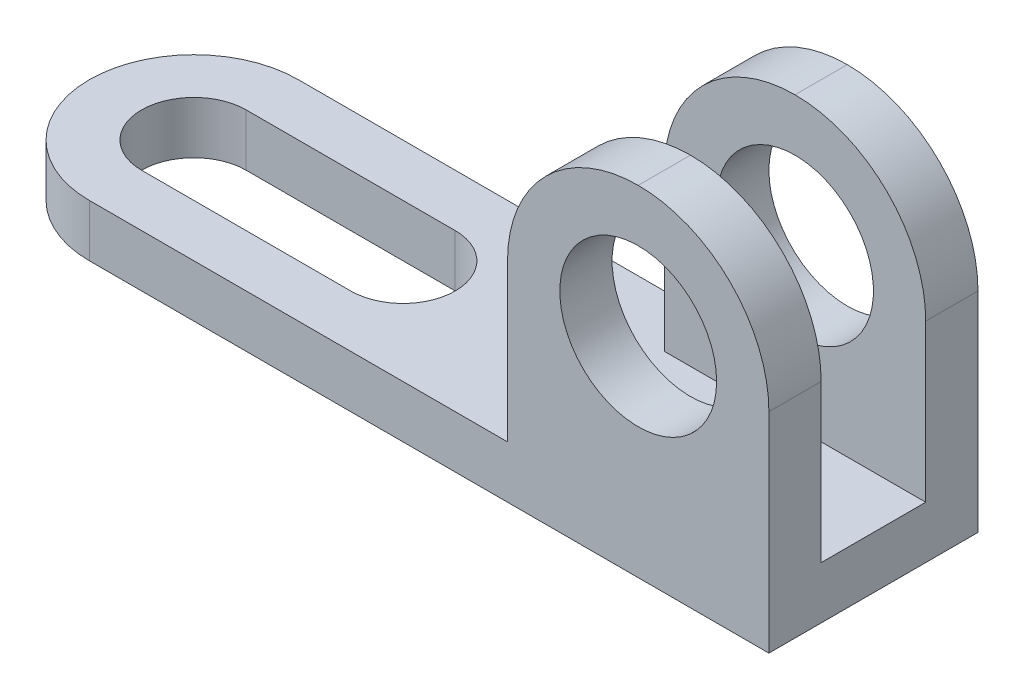
from build123d import *

# Parameters (mm, degrees)
SKETCH2_W            = 150
SKETCH2_H            = 40
BOSS_EXTRUDE1_DEPTH  = 10
FILLET2_R            = 20
SKETCH10_W           = 50
SKETCH10_H           = 10
BOSS_EXTRUDE4_DEPTH  = 55
SKETCH12_R           = 15
CUT_EXTRUDE2_DEPTH   = 10
FILLET3_R            = 25
FILLET3_OF_MIRROR1_R = 25
FILLET4_R            = 20
CUT_EXTRUDE4_DEPTH   = 10


with BuildPart() as part:
    # Sketch2 → Boss-Extrude1 (new body)
    with BuildSketch(Plane(origin=(0, 0, 0), x_dir=(1, 0, 0), z_dir=(0, 1, 0))):
        Rectangle(SKETCH2_W, SKETCH2_H)
    boss_extrude1 = extrude(amount=BOSS_EXTRUDE1_DEPTH)

    # Fillet2
    fillet2_edges = [part.edges().sort_by_distance(p)[0] for p in [
        (-75, 5, 20),
        (-75, 5, -20),
    ]]
    fillet(fillet2_edges, radius=FILLET2_R - 0.0001)  # a hair under: the kernel refuses the full size

    # Sketch10 → Boss-Extrude4 (add)
    with BuildSketch(Plane(origin=(0, 10, 0), x_dir=(1, 0, 0), z_dir=(0, 1, 0))):
        with Locations((50, -15)):
            Rectangle(SKETCH10_W, SKETCH10_H)
    boss_extrude4 = extrude(amount=BOSS_EXTRUDE4_DEPTH)

    # Sketch12 → Cut-Extrude2 (cut)
    with BuildSketch(Plane.XY.offset(20)):
        with Locations((50, 40)):
            Circle(SKETCH12_R)
    cut_extrude2 = extrude(amount=-CUT_EXTRUDE2_DEPTH, mode=Mode.SUBTRACT)

    # Fillet3
    fillet3_edges = [part.edges().sort_by_distance(p)[0] for p in [
        (75, 65, 15),
        (25, 65, 15),
    ]]
    fillet(fillet3_edges, radius=FILLET3_R - 0.0001)  # a hair under: the kernel refuses the full size

    # Mirror1: Boss-Extrude1, Boss-Extrude4 across plane
    add(boss_extrude1.mirror(Plane.XY))
    add(boss_extrude4.mirror(Plane.XY))

    # Fillet3 of Mirror1
    fillet3_of_mirror1_edges = [part.edges().sort_by_distance(p)[0] for p in [
        (75, 65, -15),
        (25, 65, -15),
    ]]
    fillet(fillet3_of_mirror1_edges, radius=FILLET3_OF_MIRROR1_R - 0.0001)  # a hair under: the kernel refuses the full size

    # Mirror2: Cut-Extrude2 across plane
    add(cut_extrude2.mirror(Plane.XY), mode=Mode.SUBTRACT)

    # Fillet4
    fillet4_edges = [part.edges().sort_by_distance(p)[0] for p in [
        (-75, 5, -20),
        (-75, 5, 20),
    ]]
    fillet(fillet4_edges, radius=FILLET4_R - 0.0001)  # a hair under: the kernel refuses the full size

    # Sketch9 → Cut-Extrude4 (cut)
    with BuildSketch(Plane(origin=(0, 10, 0), x_dir=(1, 0, 0), z_dir=(0, 1, 0))):
        with BuildLine():
            Line((-55, 10), (-15, 10))
            ThreePointArc((-15, 10), (-5, 0), (-15, -10))
            Line((-15, -10), (-55, -10))
            ThreePointArc((-55, -10), (-65, 0), (-55, 10))
        make_face()
    extrude(amount=-CUT_EXTRUDE4_DEPTH, mode=Mode.SUBTRACT)


solid = part.part
